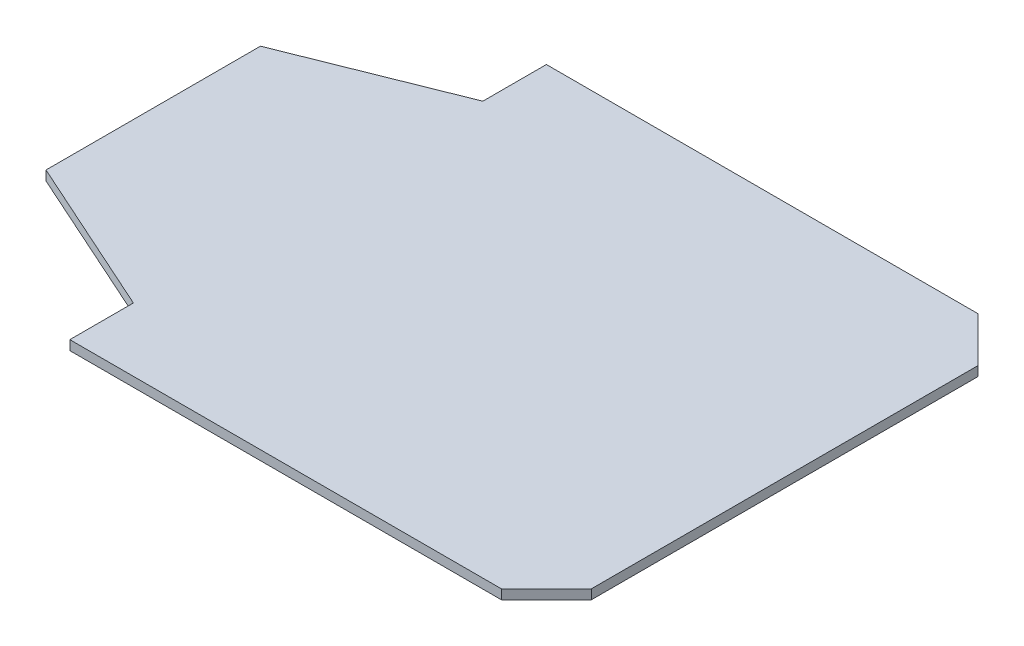
from build123d import *

# Parameters (mm, degrees)
BOSS_EXTRUDE1_DEPTH = 6
CUT_EXTRUDE1_DEPTH  = 10


with BuildPart() as part:
    # Sketch1 → Boss-Extrude1 (new body)
    with BuildSketch(Plane(origin=(0, 0, 0), x_dir=(1, 0, 0), z_dir=(0, 1, 0))):
        Polygon((-245.183632637, 942.323086709), (-245.183632637, 742.323086709), (-245.183632637, 692.323086709), (-145.183632637, 692.323086709), (126.532096115, 692.323086709), (154.816367363, 720.607357957), (154.816367363, 964.038815462), (126.532096115, 992.323086709), (-145.183632637, 992.323086709), (-245.183632637, 992.323086709), align=None)
    extrude(amount=BOSS_EXTRUDE1_DEPTH)

    # Sketch2 → Cut-Extrude1 (cut)
    with BuildSketch(Plane(origin=(0, 6, 0), x_dir=(1, 0, 0), z_dir=(0, 1, 0))):
        Polygon((-245.183632637, 912.323086709), (-145.183632637, 952.323086709), (-145.183632637, 992.323086709), (-245.183632637, 992.323086709), align=None)
        Polygon((-245.183632637, 777.323086709), (-145.183632637, 732.323086709), (-145.183632637, 692.323086709), (-245.183632637, 692.323086709), align=None)
    extrude(amount=-CUT_EXTRUDE1_DEPTH, mode=Mode.SUBTRACT)


solid = part.part
